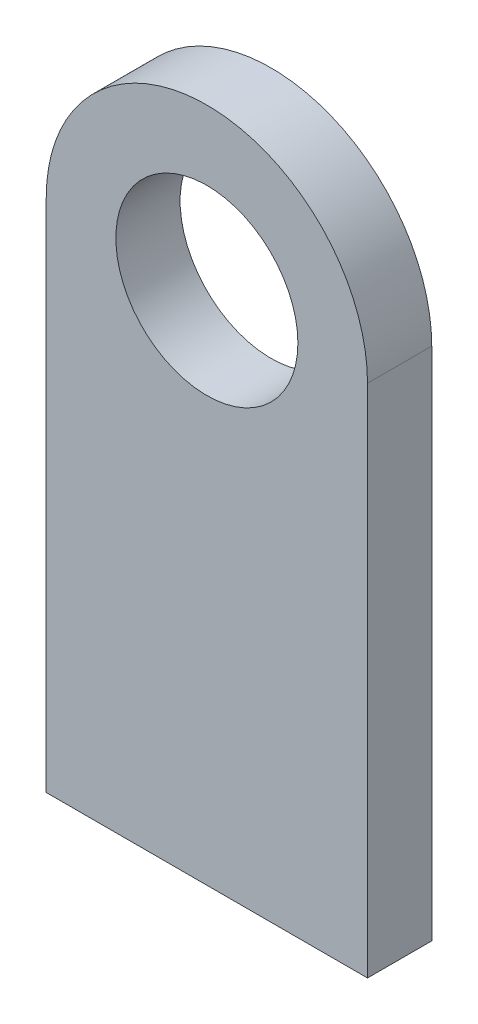
from build123d import *

# Parameters (mm, degrees)
SKETCH1_R           = 8.5
BOSS_EXTRUDE1_DEPTH = 6


with BuildPart() as part:
    # Sketch1 → Boss-Extrude1 (new body)
    with BuildSketch(Plane.XY):
        with BuildLine():
            Line((-15, 0), (-15, 48.1))
            ThreePointArc((-15, 48.1), (0, 63.1), (15, 48.1))
            Line((15, 48.1), (15, 0))
            Line((15, 0), (-15, 0))
        make_face()
        with Locations((0, 48.1)):
            Circle(SKETCH1_R, mode=Mode.SUBTRACT)
    extrude(amount=BOSS_EXTRUDE1_DEPTH)


solid = part.part
